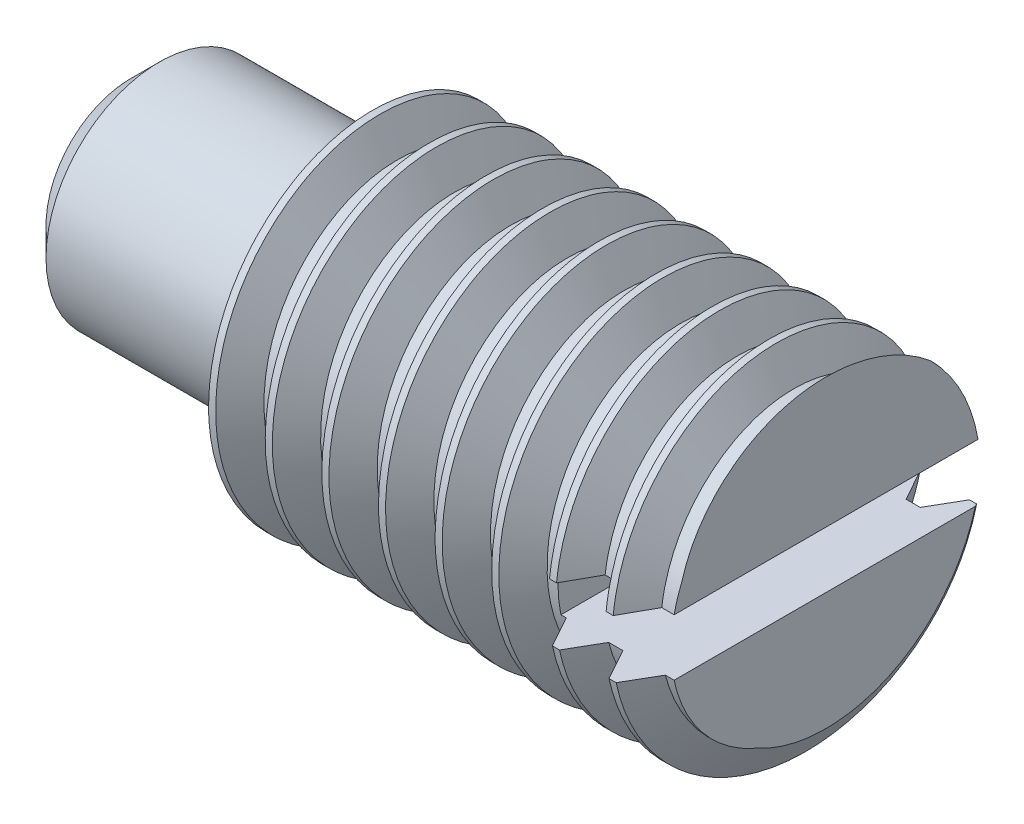
from build123d import *

# Parameters (mm, degrees)
CUT_EXTRUDE1_DEPTH      = 13.727922061
CUT_EXTRUDE1_DEPTH_BACK = 13.727922061
SKETCH2_W               = 4
SKETCH2_H               = 1
THREAD1_PITCH           = 1
CHAMFER1_SIZE           = 0.5


with BuildPart() as part:
    # Sketch1 → Revolve1 (revolve)
    with BuildSketch(Plane.XY, mode=Mode.PRIVATE) as revolve1_sk:
        Polygon((0, 2), (4, 2), (4, 3), (12, 3), (12, 0), (0, 0), align=None)
    revolve(revolve1_sk.sketch.rotate(Axis((0, 0, 0), (1, 0, 0)), 90), axis=Axis((0, 0, 0), (1, 0, 0)))

    # Sketch2 → Cut-Extrude1 (cut, two sides: drawn at the far end of the back side and taken through both)
    with BuildSketch(Plane.XY.offset(-CUT_EXTRUDE1_DEPTH_BACK)):
        with Locations((12, 0)):
            Rectangle(SKETCH2_W, SKETCH2_H)
    extrude(amount=CUT_EXTRUDE1_DEPTH + CUT_EXTRUDE1_DEPTH_BACK, mode=Mode.SUBTRACT)

    # Thread1: the profile of Thread Profile1 profile screwed along a right-hand helix of 10 turns, 8 arcs to a turn; built about Z, then put on its axis
    thread1_z = Axis((0, 0, 0), (0, 0, 1))
    thread1_corners = [(3.0003, 0, -0.000173205), (3.0003, 0, 0.875173202), (2.458734125, 0, 0.562499999), (2.458734125, 0, 0.312499999)]
    with BuildLine(mode=Mode.PRIVATE) as thread1_profile:
        Line(thread1_corners[0], thread1_corners[1])
        Line(thread1_corners[1], thread1_corners[2])
        Line(thread1_corners[2], thread1_corners[3])
        Line(thread1_corners[3], thread1_corners[0])
    thread1_cap = Face(thread1_profile.wire())
    thread1_turn_angles = [0, 22.5, 45, 67.5, 90, 112.5, 135, 157.5, 180, 202.5, 225, 247.5, 270, 292.5, 315, 337.5, 360]
    thread1_turn_weights = [1, 0.9238795325112867, 1, 0.9238795325112867, 1, 0.9238795325112867, 1, 0.9238795325112867, 1, 0.9238795325112867, 1, 0.9238795325112867, 1, 0.9238795325112867, 1, 0.9238795325112867, 1]
    thread1_turn_rails = [Edge.make_bspline([Vector(p[0], p[1], 0).rotate(thread1_z, thread1_turn_angles[k]) / thread1_turn_weights[k] + Vector(0, 0, p[2] + THREAD1_PITCH * thread1_turn_angles[k] / 360) for k in range(17)], [0, 0, 0, 1, 1, 2, 2, 3, 3, 4, 4, 5, 5, 6, 6, 7, 7, 8, 8, 8], 2, thread1_turn_weights) for p in thread1_corners]
    thread1_turn_sides = [Face.make_surface_from_curves(thread1_turn_rails[p[0]], thread1_turn_rails[p[1]]) for p in [(0, 1), (1, 2), (2, 3), (3, 0)]]
    thread1 = Plane(origin=(3, 0, 0), x_dir=(0, 0, -1), z_dir=(1, 0, 0)) * Solid(Shell([*[p.moved(Location((0, 0, THREAD1_PITCH * i))) for i in range(10) for p in thread1_turn_sides], thread1_cap, thread1_cap.rotate(thread1_z, 3600).moved(Location((0, 0, THREAD1_PITCH * 3600 / 360)))]))
    add(thread1, mode=Mode.SUBTRACT)

    # Chamfer1
    chamfer1_edges = [part.edges().sort_by_distance(p)[0] for p in [
        (0, 0, -2),
    ]]
    chamfer(chamfer1_edges, length=CHAMFER1_SIZE)


solid = part.part
